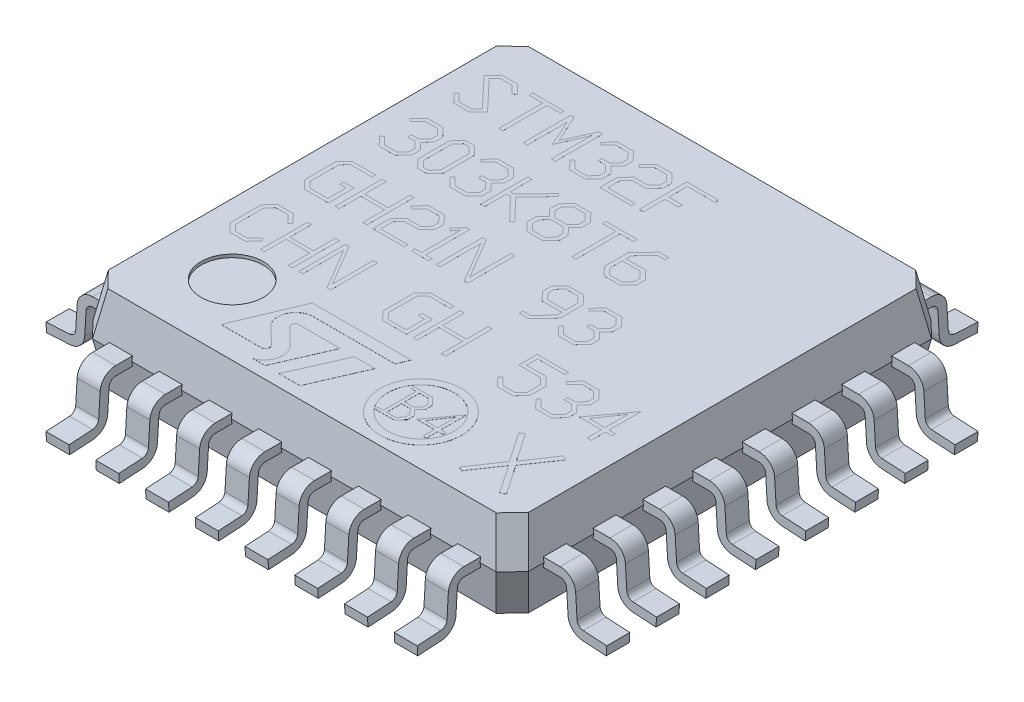
from build123d import *
from OCP.BRepFilletAPI import BRepFilletAPI_MakeChamfer

# Parameters (mm, degrees)
SKETCH1_W                  = 7
SKETCH1_H                  = 7
BOSS_EXTRUDE1_DEPTH        = 1.4
CHAMFER1_SIZE              = 0.7
CHAMFER1_SIZE_2            = 0.123428886
BOSS_EXTRUDE2_DEPTH        = 0.185
BOSS_EXTRUDE2_DEPTH_BACK   = 0.185
CHAMFER2_SIZE              = 0.25
CHAMFER2_SIZE2             = 0.257893718
FILLET2_R                  = 0.25
FILLET3_R                  = 0.105
LPATTERN2_COUNT            = 8
LPATTERN2_PITCH            = 0.8
SKETCH6_R                  = 0.5
PIN_1_IDENTIFICATION_DEPTH = 0.05
MARKINGS_1_DEPTH           = 0.0001
MARKINGS_1_2_DEPTH         = 0.0001
MARKINGS_1_3_DEPTH         = 0.0001
MARKINGS_1_4_DEPTH         = 0.0001
MARKINGS_1_5_DEPTH         = 0.0001
MARKINGS_1_6_DEPTH         = 0.0001
MARKINGS_1_7_DEPTH         = 0.0001
MARKINGS_1_8_DEPTH         = 0.0001
MARKINGS_1_9_DEPTH         = 0.0001
MARKINGS_1_10_DEPTH        = 0.0001
MARKINGS_1_11_DEPTH        = 0.0001
MARKINGS_1_12_DEPTH        = 0.0001
MARKINGS_1_13_DEPTH        = 0.0001
MARKINGS_1_14_DEPTH        = 0.0001
MARKINGS_1_15_DEPTH        = 0.0001
MARKINGS_1_16_DEPTH        = 0.0001
MARKINGS_1_17_DEPTH        = 0.0001
MARKINGS_1_18_DEPTH        = 0.0001
MARKINGS_1_19_DEPTH        = 0.0001
MARKINGS_1_20_DEPTH        = 0.0001
MARKINGS_1_21_DEPTH        = 0.0001
MARKINGS_1_22_DEPTH        = 0.0001
MARKINGS_1_23_DEPTH        = 0.0001
MARKINGS_1_24_DEPTH        = 0.0001
MARKINGS_1_25_DEPTH        = 0.0001
MARKINGS_1_26_DEPTH        = 0.0001
MARKINGS_1_27_DEPTH        = 0.0001
MARKINGS_1_28_DEPTH        = 0.0001
MARKINGS_2_DEPTH           = 0.001
MARKINGS_2_2_DEPTH         = 0.001
MARKINGS_2_3_DEPTH         = 0.001
MARKINGS_3_DEPTH           = 0.001
MARKINGS_3_2_DEPTH         = 0.001
SKETCH11_R                 = 0.653338309
SKETCH11_R_2               = 0.534659599
MARKINGS_4_DEPTH           = 0.001
MARKINGS_5_DEPTH           = 0.001


with BuildPart() as part:
    # Sketch1 → Boss-Extrude1 (new body)
    with BuildSketch(Plane(origin=(0, 0, 0), x_dir=(1, 0, 0), z_dir=(0, 1, 0))):
        with Locations((3.5, 3.5)):
            Rectangle(SKETCH1_W, SKETCH1_H)
    extrude(amount=BOSS_EXTRUDE1_DEPTH)

    # Chamfer1
    # the kernel refuses this chamfer: 0.7, 0.123428886 mm, written as the material it takes off along each edge
    with BuildSketch(Plane(origin=(8.818977157, 0, -7), x_dir=(0, 0.9999776716360547, -0.006682531656101123), z_dir=(-1, 0, 0)), Plane(origin=(0, 0, -8.818977157), x_dir=(-0.006682531656101709, 0.9999776716360547, 0), z_dir=(0, 0, 1)), Plane(origin=(-1.818977157, 0, 0), x_dir=(0, 0.9999776716360547, 0.006682531656101709), z_dir=(1, 0, 0)), Plane(origin=(7, 0, 1.818977157), x_dir=(0.006682531656101123, 0.9999776716360547, 0), z_dir=(0, 0, -1))) as chamfer1_piece_1:
        Polygon((CHAMFER1_SIZE * 0.999977671636, -CHAMFER1_SIZE * 0.0066825316561), (-CHAMFER1_SIZE_2 * 0.00668253168295, -CHAMFER1_SIZE_2 * 0.999977675654), (0, 0), align=None)
    extrude(amount=10.637954315, mode=Mode.SUBTRACT)
    with BuildSketch(Plane(origin=(8.818977157, 1.4, -7), x_dir=(0, -0.9999776716360547, -0.006682531656101123), z_dir=(-1, 0, 0)), Plane(origin=(0, 1.4, -8.818977157), x_dir=(-0.006682531656101709, -0.9999776716360547, 0), z_dir=(0, 0, 1)), Plane(origin=(-1.818977157, 1.4, 0), x_dir=(0, -0.9999776716360547, 0.006682531656101709), z_dir=(1, 0, 0)), Plane(origin=(7, 1.4, 1.818977157), x_dir=(0.006682531656101123, -0.9999776716360547, 0), z_dir=(0, 0, -1))) as chamfer1_piece_2:
        Polygon((CHAMFER1_SIZE * 0.999977671636, CHAMFER1_SIZE * 0.0066825316561), (-CHAMFER1_SIZE_2 * 0.00668253168295, CHAMFER1_SIZE_2 * 0.999977675654), (0, 0), align=None)
    extrude(amount=10.637954315, mode=Mode.SUBTRACT)

    # Chamfer2: one chamfer whose edges measure the first distance from different faces: ONE call of the kernel's chamfer builder (chamfer() names one face for all edges)
    chamfer2_edges_1 = [part.edges().sort_by_distance(p)[0] for p in [
        (6.938285557, 1.05, -0.061714443),
        (0.061714443, 1.05, -0.061714443),
    ]]
    chamfer2_side_1 = [part.faces().sort_by_distance(p)[0] for p in [
        (3.5, 1.047905928, -0.061345202),
    ]]
    chamfer2_edges_2 = [part.edges().sort_by_distance(p)[0] for p in [
        (6.938285557, 0.35, -0.061714443),
        (0.061714443, 0.35, -0.061714443),
    ]]
    chamfer2_side_2 = [part.faces().sort_by_distance(p)[0] for p in [
        (3.5, 0.352094072, -0.061345202),
    ]]
    chamfer2_edges_3 = [part.edges().sort_by_distance(p)[0] for p in [
        (6.938285557, 1.05, -6.938285557),
    ]]
    chamfer2_side_3 = [part.faces().sort_by_distance(p)[0] for p in [
        (6.938654798, 1.047905928, -3.5),
    ]]
    chamfer2_edges_4 = [part.edges().sort_by_distance(p)[0] for p in [
        (0.061714443, 1.05, -6.938285557),
    ]]
    chamfer2_side_4 = [part.faces().sort_by_distance(p)[0] for p in [
        (0.061345202, 1.047905928, -3.5),
    ]]
    chamfer2_edges_5 = [part.edges().sort_by_distance(p)[0] for p in [
        (6.938285557, 0.35, -6.938285557),
    ]]
    chamfer2_side_5 = [part.faces().sort_by_distance(p)[0] for p in [
        (6.938654798, 0.352094072, -3.5),
    ]]
    chamfer2_edges_6 = [part.edges().sort_by_distance(p)[0] for p in [
        (0.061714443, 0.35, -6.938285557),
    ]]
    chamfer2_side_6 = [part.faces().sort_by_distance(p)[0] for p in [
        (0.061345202, 0.352094072, -3.5),
    ]]
    chamfer2 = BRepFilletAPI_MakeChamfer(part.part.solid().wrapped)
    for e in chamfer2_edges_1:
        chamfer2.Add(CHAMFER2_SIZE, CHAMFER2_SIZE2, e.wrapped, chamfer2_side_1[0].wrapped)  # the first distance lies on this face
    for e in chamfer2_edges_2:
        chamfer2.Add(CHAMFER2_SIZE, CHAMFER2_SIZE2, e.wrapped, chamfer2_side_2[0].wrapped)  # the first distance lies on this face
    for e in chamfer2_edges_3:
        chamfer2.Add(CHAMFER2_SIZE, CHAMFER2_SIZE2, e.wrapped, chamfer2_side_3[0].wrapped)  # the first distance lies on this face
    for e in chamfer2_edges_4:
        chamfer2.Add(CHAMFER2_SIZE, CHAMFER2_SIZE2, e.wrapped, chamfer2_side_4[0].wrapped)  # the first distance lies on this face
    for e in chamfer2_edges_5:
        chamfer2.Add(CHAMFER2_SIZE, CHAMFER2_SIZE2, e.wrapped, chamfer2_side_5[0].wrapped)  # the first distance lies on this face
    for e in chamfer2_edges_6:
        chamfer2.Add(CHAMFER2_SIZE, CHAMFER2_SIZE2, e.wrapped, chamfer2_side_6[0].wrapped)  # the first distance lies on this face
    add(Compound.cast(chamfer2.Shape()), mode=Mode.REPLACE)

    # Sketch6 → Pin 1 Identification (cut)
    with BuildSketch(Plane(origin=(0, 1.4, 0), x_dir=(1, 0, 0), z_dir=(0, 1, 0))):
        with Locations(Location((1.25, 1.25, 0), (0, 0, 270))):
            Circle(SKETCH6_R)
    extrude(amount=-PIN_1_IDENTIFICATION_DEPTH, mode=Mode.SUBTRACT)


with BuildPart() as body_2:
    # Sketch4 → Boss-Extrude2 (new, two sides: drawn at the far end of the back side and taken through both)
    with BuildSketch(Plane.XY.offset(-0.7).offset(-BOSS_EXTRUDE2_DEPTH_BACK)):
        Polygon((6.987216294, 0.7725), (7.494151093, 0.7725), (7.536897924, 0.073595496), (8.008852038, 0.044729546), (8, -0.1), (7.4, -0.063302428), (7.357748714, 0.6275), (6.987216294, 0.6275), (7, 0.7), align=None)
    extrude(amount=BOSS_EXTRUDE2_DEPTH + BOSS_EXTRUDE2_DEPTH_BACK)

    # Fillet2
    fillet2_edges = [body_2.edges().sort_by_distance(p)[0] for p in [
        (7.494151093, 0.7725, -0.7),
        (7.4, -0.063302428, -0.7),
    ]]
    fillet(fillet2_edges, radius=FILLET2_R)

    # Fillet3
    fillet3_edges = [body_2.edges().sort_by_distance(p)[0] for p in [
        (7.536897924, 0.073595496, -0.7),
        (7.357748714, 0.6275, -0.7),
    ]]
    fillet(fillet3_edges, radius=FILLET3_R)


with BuildPart() as lpattern2_1:
    # LPattern2: pattern copy
    add(body_2.part.moved(Location(Vector(0, 0, -1) * (1 * LPATTERN2_PITCH))))


with BuildPart() as lpattern2_2:
    # LPattern2: pattern copy
    add(body_2.part.moved(Location(Vector(0, 0, -1) * (2 * LPATTERN2_PITCH))))


with BuildPart() as lpattern2_3:
    # LPattern2: pattern copy
    add(body_2.part.moved(Location(Vector(0, 0, -1) * (3 * LPATTERN2_PITCH))))


with BuildPart() as lpattern2_4:
    # LPattern2: pattern copy
    add(body_2.part.moved(Location(Vector(0, 0, -1) * (4 * LPATTERN2_PITCH))))


with BuildPart() as lpattern2_5:
    # LPattern2: pattern copy
    add(body_2.part.moved(Location(Vector(0, 0, -1) * (5 * LPATTERN2_PITCH))))


with BuildPart() as lpattern2_6:
    # LPattern2: pattern copy
    add(body_2.part.moved(Location(Vector(0, 0, -1) * (6 * LPATTERN2_PITCH))))


with BuildPart() as lpattern2_7:
    # LPattern2: pattern copy
    add(body_2.part.moved(Location(Vector(0, 0, -1) * (7 * LPATTERN2_PITCH))))


with BuildPart() as body_10:
    # Mirror1: mirrored copy
    add(body_2.part.mirror(Plane(origin=(0, 0, 0), x_dir=(-0.7071067811865477, 0, 0.7071067811865474), z_dir=(0.7071067811865476, 0, 0.7071067811865476))))


with BuildPart() as body_11:
    # Mirror1 2: mirrored copy
    add(lpattern2_1.part.mirror(Plane(origin=(0, 0, 0), x_dir=(-0.7071067811865477, 0, 0.7071067811865474), z_dir=(0.7071067811865476, 0, 0.7071067811865476))))


with BuildPart() as body_12:
    # Mirror1 3: mirrored copy
    add(lpattern2_2.part.mirror(Plane(origin=(0, 0, 0), x_dir=(-0.7071067811865477, 0, 0.7071067811865474), z_dir=(0.7071067811865476, 0, 0.7071067811865476))))


with BuildPart() as body_13:
    # Mirror1 4: mirrored copy
    add(lpattern2_3.part.mirror(Plane(origin=(0, 0, 0), x_dir=(-0.7071067811865477, 0, 0.7071067811865474), z_dir=(0.7071067811865476, 0, 0.7071067811865476))))


with BuildPart() as body_14:
    # Mirror1 5: mirrored copy
    add(lpattern2_4.part.mirror(Plane(origin=(0, 0, 0), x_dir=(-0.7071067811865477, 0, 0.7071067811865474), z_dir=(0.7071067811865476, 0, 0.7071067811865476))))


with BuildPart() as body_15:
    # Mirror1 6: mirrored copy
    add(lpattern2_5.part.mirror(Plane(origin=(0, 0, 0), x_dir=(-0.7071067811865477, 0, 0.7071067811865474), z_dir=(0.7071067811865476, 0, 0.7071067811865476))))


with BuildPart() as body_16:
    # Mirror1 7: mirrored copy
    add(lpattern2_6.part.mirror(Plane(origin=(0, 0, 0), x_dir=(-0.7071067811865477, 0, 0.7071067811865474), z_dir=(0.7071067811865476, 0, 0.7071067811865476))))


with BuildPart() as body_17:
    # Mirror1 8: mirrored copy
    add(lpattern2_7.part.mirror(Plane(origin=(0, 0, 0), x_dir=(-0.7071067811865477, 0, 0.7071067811865474), z_dir=(0.7071067811865476, 0, 0.7071067811865476))))


with BuildPart() as body_18:
    # Mirror2: mirrored copy
    add(body_2.part.mirror(Plane(origin=(3.5, 0, -3.5), x_dir=(0.7071067811865478, 0, 0.7071067811865472), z_dir=(0.7071067811865475, 0, -0.7071067811865477))))


with BuildPart() as body_19:
    # Mirror2 2: mirrored copy
    add(lpattern2_1.part.mirror(Plane(origin=(3.5, 0, -3.5), x_dir=(0.7071067811865478, 0, 0.7071067811865472), z_dir=(0.7071067811865475, 0, -0.7071067811865477))))


with BuildPart() as body_20:
    # Mirror2 3: mirrored copy
    add(lpattern2_2.part.mirror(Plane(origin=(3.5, 0, -3.5), x_dir=(0.7071067811865478, 0, 0.7071067811865472), z_dir=(0.7071067811865475, 0, -0.7071067811865477))))


with BuildPart() as body_21:
    # Mirror2 4: mirrored copy
    add(lpattern2_3.part.mirror(Plane(origin=(3.5, 0, -3.5), x_dir=(0.7071067811865478, 0, 0.7071067811865472), z_dir=(0.7071067811865475, 0, -0.7071067811865477))))


with BuildPart() as body_22:
    # Mirror2 5: mirrored copy
    add(lpattern2_4.part.mirror(Plane(origin=(3.5, 0, -3.5), x_dir=(0.7071067811865478, 0, 0.7071067811865472), z_dir=(0.7071067811865475, 0, -0.7071067811865477))))


with BuildPart() as body_23:
    # Mirror2 6: mirrored copy
    add(lpattern2_5.part.mirror(Plane(origin=(3.5, 0, -3.5), x_dir=(0.7071067811865478, 0, 0.7071067811865472), z_dir=(0.7071067811865475, 0, -0.7071067811865477))))


with BuildPart() as body_24:
    # Mirror2 7: mirrored copy
    add(lpattern2_6.part.mirror(Plane(origin=(3.5, 0, -3.5), x_dir=(0.7071067811865478, 0, 0.7071067811865472), z_dir=(0.7071067811865475, 0, -0.7071067811865477))))


with BuildPart() as body_25:
    # Mirror2 8: mirrored copy
    add(lpattern2_7.part.mirror(Plane(origin=(3.5, 0, -3.5), x_dir=(0.7071067811865478, 0, 0.7071067811865472), z_dir=(0.7071067811865475, 0, -0.7071067811865477))))


with BuildPart() as body_26:
    # Mirror2 9: mirrored copy
    add(body_17.part.mirror(Plane(origin=(3.5, 0, -3.5), x_dir=(0.7071067811865478, 0, 0.7071067811865472), z_dir=(0.7071067811865475, 0, -0.7071067811865477))))


with BuildPart() as body_27:
    # Mirror2 10: mirrored copy
    add(body_16.part.mirror(Plane(origin=(3.5, 0, -3.5), x_dir=(0.7071067811865478, 0, 0.7071067811865472), z_dir=(0.7071067811865475, 0, -0.7071067811865477))))


with BuildPart() as body_28:
    # Mirror2 11: mirrored copy
    add(body_15.part.mirror(Plane(origin=(3.5, 0, -3.5), x_dir=(0.7071067811865478, 0, 0.7071067811865472), z_dir=(0.7071067811865475, 0, -0.7071067811865477))))


with BuildPart() as body_29:
    # Mirror2 12: mirrored copy
    add(body_14.part.mirror(Plane(origin=(3.5, 0, -3.5), x_dir=(0.7071067811865478, 0, 0.7071067811865472), z_dir=(0.7071067811865475, 0, -0.7071067811865477))))


with BuildPart() as body_30:
    # Mirror2 13: mirrored copy
    add(body_13.part.mirror(Plane(origin=(3.5, 0, -3.5), x_dir=(0.7071067811865478, 0, 0.7071067811865472), z_dir=(0.7071067811865475, 0, -0.7071067811865477))))


with BuildPart() as body_31:
    # Mirror2 14: mirrored copy
    add(body_12.part.mirror(Plane(origin=(3.5, 0, -3.5), x_dir=(0.7071067811865478, 0, 0.7071067811865472), z_dir=(0.7071067811865475, 0, -0.7071067811865477))))


with BuildPart() as body_32:
    # Mirror2 15: mirrored copy
    add(body_11.part.mirror(Plane(origin=(3.5, 0, -3.5), x_dir=(0.7071067811865478, 0, 0.7071067811865472), z_dir=(0.7071067811865475, 0, -0.7071067811865477))))


with BuildPart() as body_33:
    # Mirror2 16: mirrored copy
    add(body_10.part.mirror(Plane(origin=(3.5, 0, -3.5), x_dir=(0.7071067811865478, 0, 0.7071067811865472), z_dir=(0.7071067811865475, 0, -0.7071067811865477))))


with BuildPart() as body_34:
    # Sketch7 → Markings 1 (new body)
    with BuildSketch(Plane(origin=(0, 1.4, 0), x_dir=(1, 0, 0), z_dir=(0, 1, 0))):
        Polygon((0.969664245, 5.636761835), (0.829876705, 5.488502324), (0.573599549, 5.488502324), (0.441224985, 5.630861712), (0.481315568, 5.669136872), (0.604007878, 5.547503558), (0.798863236, 5.547503558), (0.887516373, 5.636913121), (0.436686429, 6.114520548), (0.57390212, 6.263990341), (0.82972542, 6.263990341), (0.964671833, 6.120420671), (0.921101691, 6.082296797), (0.798863236, 6.204535251), (0.604159163, 6.204535251), (0.518985586, 6.114369262), align=None)
    extrude(amount=MARKINGS_1_DEPTH)


with BuildPart() as body_35:
    # Sketch7 → Markings 1 2 (new body)
    with BuildSketch(Plane(origin=(0, 1.4, 0), x_dir=(1, 0, 0), z_dir=(0, 1, 0))):
        Polygon((1.574714338, 6.204535251), (1.356863627, 6.204535251), (1.356863627, 5.496066584), (1.289844276, 5.496066584), (1.289844276, 6.204535251), (1.071993565, 6.204535251), (1.071993565, 6.263990341), (1.574714338, 6.263990341), align=None)
    extrude(amount=MARKINGS_1_2_DEPTH)


with BuildPart() as body_36:
    # Sketch7 → Markings 1 3 (new body)
    with BuildSketch(Plane(origin=(0, 1.4, 0), x_dir=(1, 0, 0), z_dir=(0, 1, 0))):
        Polygon((2.20321364, 5.496066584), (2.136043004, 5.496066584), (2.136043004, 6.138877467), (1.943608209, 5.701511908), (1.752383696, 6.138877467), (1.752383696, 5.496066584), (1.68521306, 5.496066584), (1.68521306, 6.255972225), (1.744063009, 6.255972225), (1.943608209, 5.81149626), (2.143153409, 6.255972225), (2.20321364, 6.255972225), align=None)
    extrude(amount=MARKINGS_1_3_DEPTH)


with BuildPart() as body_37:
    # Sketch7 → Markings 1 4 (new body)
    with BuildSketch(Plane(origin=(0, 1.4, 0), x_dir=(1, 0, 0), z_dir=(0, 1, 0))):
        Polygon((2.82384611, 5.627836008), (2.691774117, 5.488502324), (2.435496961, 5.488502324), (2.303122397, 5.630861712), (2.343212979, 5.669136872), (2.465905289, 5.547503558), (2.660760647, 5.547503558), (2.756675474, 5.648410797), (2.756675474, 5.744628194), (2.660609362, 5.845838004), (2.538824763, 5.845838004), (2.538824763, 5.90574695), (2.660911933, 5.90574695), (2.756675474, 6.007108044), (2.756675474, 6.103174156), (2.660760647, 6.204535251), (2.466056574, 6.204535251), (2.34381812, 6.082296797), (2.303122397, 6.120420671), (2.435648246, 6.263990341), (2.691471546, 6.263990341), (2.82384611, 6.123143805), (2.82384611, 5.98638197), (2.71885417, 5.875792477), (2.82384611, 5.764900413), align=None)
    extrude(amount=MARKINGS_1_4_DEPTH)


with BuildPart() as body_38:
    # Sketch7 → Markings 1 5 (new body)
    with BuildSketch(Plane(origin=(0, 1.4, 0), x_dir=(1, 0, 0), z_dir=(0, 1, 0))):
        Polygon((3.444478581, 5.98638197), (3.312255302, 5.845838004), (3.08684033, 5.845838004), (2.993648637, 5.747653899), (2.993648637, 5.547503558), (3.436611749, 5.547503558), (3.436611749, 5.488502324), (2.926478001, 5.488502324), (2.926478001, 5.768077403), (3.056432001, 5.90574695), (3.281544403, 5.90574695), (3.377307945, 6.007108044), (3.377307945, 6.103174156), (3.281393118, 6.204535251), (3.086689045, 6.204535251), (2.963845449, 6.082296797), (2.923754867, 6.120571956), (3.056280716, 6.263990341), (3.312104017, 6.263990341), (3.444478581, 6.123143805), align=None)
    extrude(amount=MARKINGS_1_5_DEPTH)


with BuildPart() as body_39:
    # Sketch7 → Markings 1 6 (new body)
    with BuildSketch(Plane(origin=(0, 1.4, 0), x_dir=(1, 0, 0), z_dir=(0, 1, 0))):
        Polygon((4.05724422, 6.204535251), (3.614281107, 6.204535251), (3.614281107, 5.90574695), (3.832131818, 5.90574695), (3.832131818, 5.845838004), (3.614281107, 5.845838004), (3.614281107, 5.496066584), (3.547110471, 5.496066584), (3.547110471, 6.263990341), (4.05724422, 6.263990341), align=None)
    extrude(amount=MARKINGS_1_6_DEPTH)


with BuildPart() as body_40:
    # Sketch7 → Markings 1 7 (new body)
    with BuildSketch(Plane(origin=(0, 1.4, 0), x_dir=(1, 0, 0), z_dir=(0, 1, 0))):
        Polygon((0.961948699, 4.427836008), (0.829876705, 4.288502324), (0.573599549, 4.288502324), (0.441224985, 4.430861712), (0.481315568, 4.469136872), (0.604007878, 4.347503558), (0.798863236, 4.347503558), (0.894778063, 4.448410797), (0.894778063, 4.544628194), (0.798711951, 4.645838004), (0.676927352, 4.645838004), (0.676927352, 4.70574695), (0.799014521, 4.70574695), (0.894778063, 4.807108044), (0.894778063, 4.903174156), (0.798863236, 5.004535251), (0.604159163, 5.004535251), (0.481920708, 4.882296797), (0.441224985, 4.920420671), (0.573750835, 5.063990341), (0.829574135, 5.063990341), (0.961948699, 4.923143805), (0.961948699, 4.78638197), (0.856956759, 4.675792477), (0.961948699, 4.564900413), align=None)
    extrude(amount=MARKINGS_1_7_DEPTH)


with BuildPart() as body_41:
    # Sketch7 → Markings 1 8 (new body)
    with BuildSketch(Plane(origin=(0, 1.4, 0), x_dir=(1, 0, 0), z_dir=(0, 1, 0))):
        Polygon((1.469722398, 4.427836008), (1.337347834, 4.288502324), (1.19423202, 4.288502324), (1.06458059, 4.424810303), (1.06458059, 4.926320795), (1.19453459, 5.063990341), (1.337045264, 5.063990341), (1.469722398, 4.92329509), align=None)
        Polygon((1.402551762, 4.448259512), (1.402551762, 4.903174156), (1.307242076, 5.004535251), (1.224337778, 5.004535251), (1.131751226, 4.906351146), (1.131751226, 4.445233807), (1.224186493, 4.347503558), (1.307393361, 4.347503558), align=None, mode=Mode.SUBTRACT)
    extrude(amount=MARKINGS_1_8_DEPTH)


with BuildPart() as body_42:
    # Sketch7 → Markings 1 9 (new body)
    with BuildSketch(Plane(origin=(0, 1.4, 0), x_dir=(1, 0, 0), z_dir=(0, 1, 0))):
        Polygon((2.096708848, 4.427836008), (1.964636854, 4.288502324), (1.708359698, 4.288502324), (1.575985134, 4.430861712), (1.616075716, 4.469136872), (1.738768027, 4.347503558), (1.933623385, 4.347503558), (2.029538212, 4.448410797), (2.029538212, 4.544628194), (1.9334721, 4.645838004), (1.811687501, 4.645838004), (1.811687501, 4.70574695), (1.93377467, 4.70574695), (2.029538212, 4.807108044), (2.029538212, 4.903174156), (1.933623385, 5.004535251), (1.738919312, 5.004535251), (1.616680857, 4.882296797), (1.575985134, 4.920420671), (1.708510983, 5.063990341), (1.964334284, 5.063990341), (2.096708848, 4.923143805), (2.096708848, 4.78638197), (1.991716908, 4.675792477), (2.096708848, 4.564900413), align=None)
    extrude(amount=MARKINGS_1_9_DEPTH)


with BuildPart() as body_43:
    # Sketch7 → Markings 1 10 (new body)
    with BuildSketch(Plane(origin=(0, 1.4, 0), x_dir=(1, 0, 0), z_dir=(0, 1, 0))):
        Polygon((2.719610596, 4.323600494), (2.676645595, 4.285476619), (2.329143454, 4.645838004), (2.266511374, 4.645838004), (2.266511374, 4.296066584), (2.199340738, 4.296066584), (2.199340738, 5.055972225), (2.266511374, 5.055972225), (2.266511374, 4.70574695), (2.329294739, 4.70574695), (2.676645595, 5.067016045), (2.719610596, 5.028135745), (2.38617798, 4.675943762), align=None)
    extrude(amount=MARKINGS_1_10_DEPTH)


with BuildPart() as body_44:
    # Sketch7 → Markings 1 11 (new body)
    with BuildSketch(Plane(origin=(0, 1.4, 0), x_dir=(1, 0, 0), z_dir=(0, 1, 0))):
        Polygon((3.337973789, 4.427836008), (3.205447939, 4.288502324), (2.949624639, 4.288502324), (2.819973209, 4.424810303), (2.819973209, 4.568077403), (2.925116434, 4.675792477), (2.819973209, 4.783356265), (2.819973209, 4.926320795), (2.949927209, 5.063990341), (3.205145369, 5.063990341), (3.337973789, 4.92329509), (3.337973789, 4.786230684), (3.232527993, 4.675792477), (3.337973789, 4.565051699), align=None)
        Polygon((3.270803153, 4.807108044), (3.270803153, 4.903174156), (3.174888326, 5.004535251), (2.979730397, 5.004535251), (2.887143845, 4.906351146), (2.887143845, 4.80408234), (2.979579112, 4.70574695), (3.175039611, 4.70574695), align=None, mode=Mode.SUBTRACT)
        Polygon((3.270803153, 4.448410797), (3.270803153, 4.544628194), (3.17473704, 4.645838004), (2.979730397, 4.645838004), (2.887143845, 4.547805184), (2.887143845, 4.445233807), (2.979579112, 4.347503558), (3.174888326, 4.347503558), align=None, mode=Mode.SUBTRACT)
    extrude(amount=MARKINGS_1_11_DEPTH)


with BuildPart() as body_45:
    # Sketch7 → Markings 1 12 (new body)
    with BuildSketch(Plane(origin=(0, 1.4, 0), x_dir=(1, 0, 0), z_dir=(0, 1, 0))):
        Polygon((3.950739428, 5.004535251), (3.732888717, 5.004535251), (3.732888717, 4.296066584), (3.665869366, 4.296066584), (3.665869366, 5.004535251), (3.448018655, 5.004535251), (3.448018655, 5.063990341), (3.950739428, 5.063990341), align=None)
    extrude(amount=MARKINGS_1_12_DEPTH)


with BuildPart() as body_46:
    # Sketch7 → Markings 1 13 (new body)
    with BuildSketch(Plane(origin=(0, 1.4, 0), x_dir=(1, 0, 0), z_dir=(0, 1, 0))):
        Polygon((4.579238729, 4.427836008), (4.44671288, 4.288502324), (4.19088958, 4.288502324), (4.06123815, 4.424810303), (4.06123815, 4.807108044), (4.304050921, 5.063990341), (4.458664412, 5.063990341), (4.458664412, 5.004535251), (4.333854109, 5.004535251), (4.128408786, 4.786533255), (4.128408786, 4.70574695), (4.44641031, 4.70574695), (4.579238729, 4.565051699), align=None)
        Polygon((4.512068094, 4.448410797), (4.512068094, 4.544628194), (4.416001981, 4.645838004), (4.128408786, 4.645838004), (4.128408786, 4.445233807), (4.220844053, 4.347503558), (4.416153267, 4.347503558), align=None, mode=Mode.SUBTRACT)
    extrude(amount=MARKINGS_1_13_DEPTH)


with BuildPart() as body_47:
    # Sketch7 → Markings 1 14 (new body)
    with BuildSketch(Plane(origin=(0, 1.4, 0), x_dir=(1, 0, 0), z_dir=(0, 1, 0))):
        Polygon((0.958009115, 3.088576343), (0.572160067, 3.088576343), (0.443343303, 3.224006803), (0.443343303, 3.722288686), (0.57246069, 3.859071948), (0.950192929, 3.859071948), (0.950192929, 3.799999617), (0.602072011, 3.799999617), (0.51008151, 3.702447598), (0.51008151, 3.244298826), (0.6019217, 3.147197741), (0.891270908, 3.147197741), (0.891270908, 3.443611579), (0.786503948, 3.443611579), (0.786503948, 3.503134845), (0.958009115, 3.503134845), align=None)
    extrude(amount=MARKINGS_1_14_DEPTH)


with BuildPart() as body_48:
    # Sketch7 → Markings 1 15 (new body)
    with BuildSketch(Plane(origin=(0, 1.4, 0), x_dir=(1, 0, 0), z_dir=(0, 1, 0))):
        Polygon((1.572722113, 3.096091907), (1.505983906, 3.096091907), (1.505983906, 3.443611579), (1.124794508, 3.443611579), (1.124794508, 3.096091907), (1.058056301, 3.096091907), (1.058056301, 3.851105451), (1.124794508, 3.851105451), (1.124794508, 3.503134845), (1.505983906, 3.503134845), (1.505983906, 3.851105451), (1.572722113, 3.851105451), align=None)
    extrude(amount=MARKINGS_1_15_DEPTH)


with BuildPart() as body_49:
    # Sketch7 → Markings 1 16 (new body)
    with BuildSketch(Plane(origin=(0, 1.4, 0), x_dir=(1, 0, 0), z_dir=(0, 1, 0))):
        Polygon((2.187435111, 3.583250755), (2.056063055, 3.443611579), (1.832099253, 3.443611579), (1.739507506, 3.34605956), (1.739507506, 3.147197741), (2.179618925, 3.147197741), (2.179618925, 3.088576343), (1.672769299, 3.088576343), (1.672769299, 3.366351583), (1.801886686, 3.503134845), (2.025549866, 3.503134845), (2.120696904, 3.6038434), (2.120696904, 3.699291061), (2.025399555, 3.799999617), (1.831948941, 3.799999617), (1.709896185, 3.678548105), (1.670063696, 3.716576858), (1.801736375, 3.859071948), (2.055912744, 3.859071948), (2.187435111, 3.71913215), align=None)
    extrude(amount=MARKINGS_1_16_DEPTH)


with BuildPart() as body_50:
    # Sketch7 → Markings 1 17 (new body)
    with BuildSketch(Plane(origin=(0, 1.4, 0), x_dir=(1, 0, 0), z_dir=(0, 1, 0))):
        Polygon((2.570668743, 3.088576343), (2.29484755, 3.088576343), (2.29484755, 3.147197741), (2.39961451, 3.147197741), (2.39961451, 3.771741097), (2.324609183, 3.678548105), (2.284776694, 3.716576858), (2.415998439, 3.859071948), (2.465901783, 3.859071948), (2.465901783, 3.147197741), (2.570668743, 3.147197741), align=None)
    extrude(amount=MARKINGS_1_17_DEPTH)


with BuildPart() as body_51:
    # Sketch7 → Markings 1 18 (new body)
    with BuildSketch(Plane(origin=(0, 1.4, 0), x_dir=(1, 0, 0), z_dir=(0, 1, 0))):
        Polygon((3.195602908, 3.096091907), (3.137432444, 3.096091907), (2.747675303, 3.754304988), (2.747675303, 3.096091907), (2.680937096, 3.096091907), (2.680937096, 3.849752649), (2.737604447, 3.851105451), (3.128864701, 3.192892369), (3.128864701, 3.851105451), (3.195602908, 3.851105451), align=None)
    extrude(amount=MARKINGS_1_18_DEPTH)


with BuildPart() as body_52:
    # Sketch7 → Markings 1 19 (new body)
    with BuildSketch(Plane(origin=(0, 1.4, 0), x_dir=(1, 0, 0), z_dir=(0, 1, 0))):
        Polygon((4.425028904, 3.346209872), (4.181224013, 3.088576343), (4.029860557, 3.088576343), (4.029860557, 3.147197741), (4.151612691, 3.147197741), (4.358290697, 3.366351583), (4.358290697, 3.443611579), (4.039330167, 3.443611579), (3.910363092, 3.58024453), (3.910363092, 3.722288686), (4.039480479, 3.859071948), (4.293055603, 3.859071948), (4.425028904, 3.719282461), align=None)
        Polygon((4.358290697, 3.503134845), (4.358290697, 3.699291061), (4.262993347, 3.799999617), (4.0690918, 3.799999617), (3.977101299, 3.702447598), (3.977101299, 3.600837175), (4.068941489, 3.503134845), align=None, mode=Mode.SUBTRACT)
    extrude(amount=MARKINGS_1_19_DEPTH)


with BuildPart() as body_53:
    # Sketch7 → Markings 1 20 (new body)
    with BuildSketch(Plane(origin=(0, 1.4, 0), x_dir=(1, 0, 0), z_dir=(0, 1, 0))):
        Polygon((5.039741902, 3.227013029), (4.908520157, 3.088576343), (4.653892854, 3.088576343), (4.522370487, 3.230019255), (4.562202975, 3.268048008), (4.684105421, 3.147197741), (4.877706346, 3.147197741), (4.973003695, 3.247455363), (4.973003695, 3.343053335), (4.877556034, 3.443611579), (4.756555456, 3.443611579), (4.756555456, 3.503134845), (4.877856657, 3.503134845), (4.973003695, 3.6038434), (4.973003695, 3.699291061), (4.877706346, 3.799999617), (4.684255732, 3.799999617), (4.56280422, 3.678548105), (4.522370487, 3.716426547), (4.654043165, 3.859071948), (4.908219535, 3.859071948), (5.039741902, 3.71913215), (5.039741902, 3.583250755), (4.935425876, 3.473373212), (5.039741902, 3.363195046), align=None)
    extrude(amount=MARKINGS_1_20_DEPTH)


with BuildPart() as body_54:
    # Sketch7 → Markings 1 21 (new body)
    with BuildSketch(Plane(origin=(0, 1.4, 0), x_dir=(1, 0, 0), z_dir=(0, 1, 0))):
        Polygon((0.960263784, 2.030169566), (0.826336437, 1.888576343), (0.572160067, 1.888576343), (0.443343303, 2.024006803), (0.443343303, 2.522288686), (0.57246069, 2.659071948), (0.826186125, 2.659071948), (0.960263784, 2.516426547), (0.917575382, 2.478548105), (0.795973559, 2.599999617), (0.602072011, 2.599999617), (0.51008151, 2.502447598), (0.51008151, 2.044298826), (0.6019217, 1.947197741), (0.79612387, 1.947197741), (0.917575382, 2.068048008), align=None)
    extrude(amount=MARKINGS_1_21_DEPTH)


with BuildPart() as body_55:
    # Sketch7 → Markings 1 22 (new body)
    with BuildSketch(Plane(origin=(0, 1.4, 0), x_dir=(1, 0, 0), z_dir=(0, 1, 0))):
        Polygon((1.572722113, 1.896091907), (1.505983906, 1.896091907), (1.505983906, 2.243611579), (1.124794508, 2.243611579), (1.124794508, 1.896091907), (1.058056301, 1.896091907), (1.058056301, 2.651105451), (1.124794508, 2.651105451), (1.124794508, 2.303134845), (1.505983906, 2.303134845), (1.505983906, 2.651105451), (1.572722113, 2.651105451), align=None)
    extrude(amount=MARKINGS_1_22_DEPTH)


with BuildPart() as body_56:
    # Sketch7 → Markings 1 23 (new body)
    with BuildSketch(Plane(origin=(0, 1.4, 0), x_dir=(1, 0, 0), z_dir=(0, 1, 0))):
        Polygon((2.187435111, 1.896091907), (2.129264647, 1.896091907), (1.739507506, 2.554304988), (1.739507506, 1.896091907), (1.672769299, 1.896091907), (1.672769299, 2.649752649), (1.729436651, 2.651105451), (2.120696904, 1.992892369), (2.120696904, 2.651105451), (2.187435111, 2.651105451), align=None)
    extrude(amount=MARKINGS_1_23_DEPTH)


with BuildPart() as body_57:
    # Sketch7 → Markings 1 24 (new body)
    with BuildSketch(Plane(origin=(0, 1.4, 0), x_dir=(1, 0, 0), z_dir=(0, 1, 0))):
        Polygon((3.416861107, 1.888576343), (3.03101206, 1.888576343), (2.902195295, 2.024006803), (2.902195295, 2.522288686), (3.031312682, 2.659071948), (3.409044921, 2.659071948), (3.409044921, 2.599999617), (3.060924004, 2.599999617), (2.968933502, 2.502447598), (2.968933502, 2.044298826), (3.060773692, 1.947197741), (3.3501229, 1.947197741), (3.3501229, 2.243611579), (3.24535594, 2.243611579), (3.24535594, 2.303134845), (3.416861107, 2.303134845), align=None)
    extrude(amount=MARKINGS_1_24_DEPTH)


with BuildPart() as body_58:
    # Sketch7 → Markings 1 25 (new body)
    with BuildSketch(Plane(origin=(0, 1.4, 0), x_dir=(1, 0, 0), z_dir=(0, 1, 0))):
        Polygon((4.031574105, 1.896091907), (3.964835899, 1.896091907), (3.964835899, 2.243611579), (3.5836465, 2.243611579), (3.5836465, 1.896091907), (3.516908293, 1.896091907), (3.516908293, 2.651105451), (3.5836465, 2.651105451), (3.5836465, 2.303134845), (3.964835899, 2.303134845), (3.964835899, 2.651105451), (4.031574105, 2.651105451), align=None)
    extrude(amount=MARKINGS_1_25_DEPTH)


with BuildPart() as body_59:
    # Sketch7 → Markings 1 26 (new body)
    with BuildSketch(Plane(origin=(0, 1.4, 0), x_dir=(1, 0, 0), z_dir=(0, 1, 0))):
        Polygon((5.261000102, 2.027013029), (5.129778357, 1.888576343), (4.875151054, 1.888576343), (4.743628686, 2.030019255), (4.783461175, 2.068048008), (4.90536362, 1.947197741), (5.098964545, 1.947197741), (5.194261895, 2.047455363), (5.194261895, 2.262099866), (5.098814234, 2.362507799), (4.746334289, 2.362507799), (4.746334289, 2.659071948), (5.253183915, 2.659071948), (5.253183915, 2.599999617), (4.813072496, 2.599999617), (4.813072496, 2.422181376), (5.129477734, 2.422181376), (5.261000102, 2.282091266), align=None)
    extrude(amount=MARKINGS_1_26_DEPTH)


with BuildPart() as body_60:
    # Sketch7 → Markings 1 27 (new body)
    with BuildSketch(Plane(origin=(0, 1.4, 0), x_dir=(1, 0, 0), z_dir=(0, 1, 0))):
        Polygon((5.8757131, 2.027013029), (5.744491355, 1.888576343), (5.489864052, 1.888576343), (5.358341685, 2.030019255), (5.398174173, 2.068048008), (5.520076619, 1.947197741), (5.713677543, 1.947197741), (5.808974893, 2.047455363), (5.808974893, 2.143053335), (5.713527232, 2.243611579), (5.592526654, 2.243611579), (5.592526654, 2.303134845), (5.713827854, 2.303134845), (5.808974893, 2.4038434), (5.808974893, 2.499291061), (5.713677543, 2.599999617), (5.52022693, 2.599999617), (5.398775418, 2.478548105), (5.358341685, 2.516426547), (5.490014363, 2.659071948), (5.744190732, 2.659071948), (5.8757131, 2.51913215), (5.8757131, 2.383250755), (5.771397074, 2.273373212), (5.8757131, 2.163195046), align=None)
    extrude(amount=MARKINGS_1_27_DEPTH)


with BuildPart() as body_61:
    # Sketch7 → Markings 1 28 (new body)
    with BuildSketch(Plane(origin=(0, 1.4, 0), x_dir=(1, 0, 0), z_dir=(0, 1, 0))):
        Polygon((6.482609911, 2.125617227), (6.378293885, 2.125617227), (6.378293885, 1.896091907), (6.311555678, 1.896091907), (6.311555678, 2.125617227), (5.956670753, 2.125617227), (6.378293885, 2.698904437), (6.378293885, 2.184088313), (6.482609911, 2.184088313), align=None)
        Polygon((6.311555678, 2.184088313), (6.311555678, 2.560167128), (6.061137091, 2.184088313), align=None, mode=Mode.SUBTRACT)
    extrude(amount=MARKINGS_1_28_DEPTH)


with BuildPart() as body_62:
    # Sketch8 → Markings 2 (new body)
    with BuildSketch(Plane(origin=(0, 1.4, 0), x_dir=(1, 0, 0), z_dir=(0, 1, 0))):
        with BuildLine():
            Line((2.222018243, 1.565672254), (3.813871342, 1.565672254))
            Line((3.813871342, 1.565672254), (3.737180503, 1.38327242))
            Line((3.737180503, 1.38327242), (2.383690824, 1.38327242))
            ThreePointArc((2.383690824, 1.38327242), (2.159026235, 1.204940687), (2.198483552, 0.920828906))
            Line((2.198483552, 0.920828906), (2.485121103, 0.649303551))
            ThreePointArc((2.485121103, 0.649303551), (2.495234863, 0.576572113), (2.436187091, 0.532919954))
            Line((2.436187091, 0.532919954), (1.787792845, 0.532919954))
            Line((1.787792845, 0.532919954), (2.222018243, 1.565672254))
        make_face()
    extrude(amount=MARKINGS_2_DEPTH)


with BuildPart() as body_63:
    # Sketch8 → Markings 2 2 (new body)
    with BuildSketch(Plane(origin=(0, 1.4, 0), x_dir=(1, 0, 0), z_dir=(0, 1, 0))):
        with BuildLine():
            Line((2.409045558, 1.155970238), (3.080181649, 1.155970238))
            Line((3.080181649, 1.155970238), (2.715004658, 0.314582712))
            Line((2.715004658, 0.314582712), (2.522546515, 0.314582712))
            ThreePointArc((2.522546515, 0.314582712), (2.704873622, 0.506742599), (2.662766814, 0.768268149))
            Line((2.662766814, 0.768268149), (2.367733222, 1.063301741))
            ThreePointArc((2.367733222, 1.063301741), (2.360557147, 1.122043819), (2.409045558, 1.155970238))
        make_face()
    extrude(amount=MARKINGS_2_2_DEPTH)


with BuildPart() as body_64:
    # Sketch8 → Markings 2 3 (new body)
    with BuildSketch(Plane(origin=(0, 1.4, 0), x_dir=(1, 0, 0), z_dir=(0, 1, 0))):
        Polygon((3.309650974, 1.155970238), (3.640284196, 1.155970238), (3.275107205, 0.314582712), (2.93953916, 0.314582712), align=None)
    extrude(amount=MARKINGS_2_3_DEPTH)


with BuildPart() as body_65:
    # Sketch9 → Markings 3 (new body)
    with BuildSketch(Plane(origin=(0, 1.4, 0), x_dir=(1, 0, 0), z_dir=(0, 1, 0))):
        Polygon((4.614596577, 0.706164378), (4.50795609, 0.594045784), (4.203738537, 0.594045784), (4.203738537, 0.641522713), (4.288588331, 0.641522713), (4.288588331, 1.170220926), (4.203738537, 1.170220926), (4.203738537, 1.218063063), (4.507712619, 1.218063063), (4.614596577, 1.104848847), (4.614596577, 0.994556289), (4.529746783, 0.905689216), (4.614596577, 0.816578672), align=None)
        Polygon((4.560545919, 1.011355817), (4.560545919, 1.088657997), (4.483365476, 1.170220926), (4.342273781, 1.170220926), (4.342273781, 0.929792888), (4.483487211, 0.929792888), align=None, mode=Mode.SUBTRACT)
        Polygon((4.560545919, 0.722720435), (4.560545919, 0.800144351), (4.48324374, 0.881585544), (4.342273781, 0.881585544), (4.342273781, 0.641522713), (4.483365476, 0.641522713), align=None, mode=Mode.SUBTRACT)
    extrude(amount=MARKINGS_3_DEPTH)


with BuildPart() as body_66:
    # Sketch9 → Markings 3 2 (new body)
    with BuildSketch(Plane(origin=(0, 1.4, 0), x_dir=(1, 0, 0), z_dir=(0, 1, 0))):
        Polygon((5.10767492, 0.786023008), (5.023190333, 0.786023008), (5.023190333, 0.60013257), (4.969139676, 0.60013257), (4.969139676, 0.786023008), (4.681721651, 0.786023008), (5.023190333, 1.250323027), (5.023190333, 0.833378201), (5.10767492, 0.833378201), align=None)
        Polygon((4.969139676, 0.833378201), (4.969139676, 1.137960962), (4.766327973, 0.833378201), align=None, mode=Mode.SUBTRACT)
    extrude(amount=MARKINGS_3_2_DEPTH)


with BuildPart() as body_67:
    # Sketch11 → Markings 4 (new body)
    with BuildSketch(Plane(origin=(0, 1.4, 0), x_dir=(1, 0, 0), z_dir=(0, 1, 0))):
        with Locations(Location((4.613667567, 0.922645422, 0), (0, 0, 270))):
            Circle(SKETCH11_R)
        with Locations(Location((4.613667567, 0.922645422, 0), (0, 0, 270))):
            Circle(SKETCH11_R_2, mode=Mode.SUBTRACT)
    extrude(amount=MARKINGS_4_DEPTH)


with BuildPart() as body_68:
    # Sketch12 → Markings 5 (new body)
    with BuildSketch(Plane(origin=(0, 1.4, 0), x_dir=(1, 0, 0), z_dir=(0, 1, 0))):
        Polygon((6.446951898, 0.463269227), (6.369992524, 0.428998255), (6.06656416, 0.881134576), (5.76012957, 0.42839701), (5.688781817, 0.462467566), (6.01485708, 0.941459502), (5.688781817, 1.420651853), (5.76012957, 1.455724484), (6.06656416, 1.001784428), (6.370192939, 1.455724484), (6.446951898, 1.419850193), (6.120275389, 0.941659917), align=None)
    extrude(amount=MARKINGS_5_DEPTH)


solid = Compound([part.part, body_2.part, lpattern2_1.part, lpattern2_2.part, lpattern2_3.part, lpattern2_4.part, lpattern2_5.part, lpattern2_6.part, lpattern2_7.part, body_10.part, body_11.part, body_12.part, body_13.part, body_14.part, body_15.part, body_16.part, body_17.part, body_18.part, body_19.part, body_20.part, body_21.part, body_22.part, body_23.part, body_24.part, body_25.part, body_26.part, body_27.part, body_28.part, body_29.part, body_30.part, body_31.part, body_32.part, body_33.part, body_34.part, body_35.part, body_36.part, body_37.part, body_38.part, body_39.part, body_40.part, body_41.part, body_42.part, body_43.part, body_44.part, body_45.part, body_46.part, body_47.part, body_48.part, body_49.part, body_50.part, body_51.part, body_52.part, body_53.part, body_54.part, body_55.part, body_56.part, body_57.part, body_58.part, body_59.part, body_60.part, body_61.part, body_62.part, body_63.part, body_64.part, body_65.part, body_66.part, body_67.part, body_68.part])
